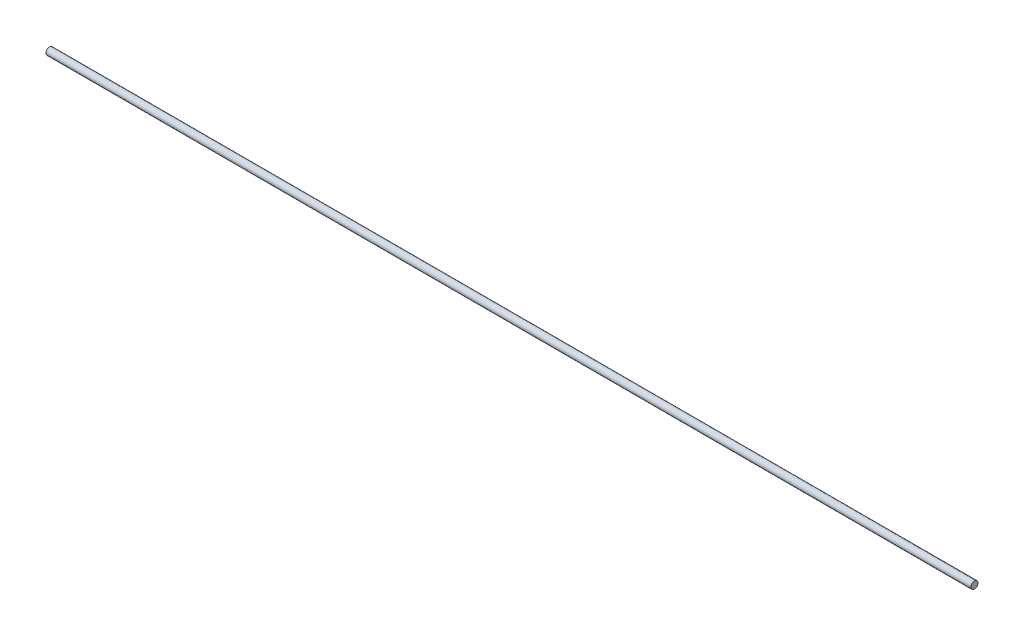
from build123d import *

# Parameters (mm, degrees)
SKETCH1_R           = 3.1369
BOSS_EXTRUDE1_DEPTH = 812.8


with BuildPart() as part:
    # Sketch1 → Boss-Extrude1 (new body)
    with BuildSketch(Plane(origin=(0, 0, 0), x_dir=(0, 0, -1), z_dir=(1, 0, 0))):
        Circle(SKETCH1_R)
    extrude(amount=BOSS_EXTRUDE1_DEPTH)


solid = part.part
